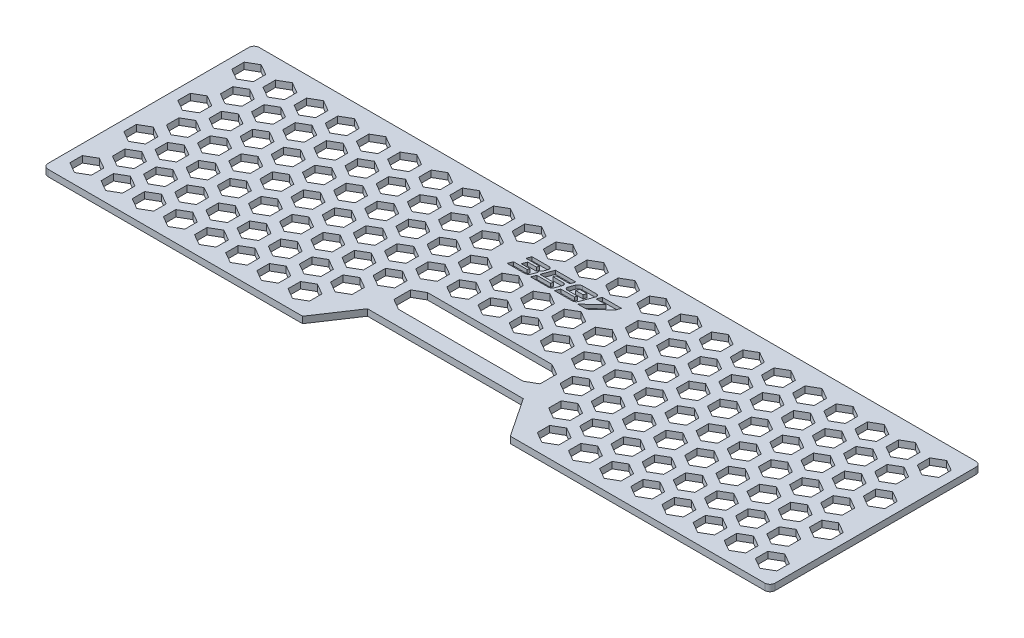
from build123d import *

# Parameters (mm, degrees)
BOSS_EXTRUDE1_DEPTH = 3.175
CUT_EXTRUDE1_DEPTH  = 197.755505707
FILL_PATTERN1_DEPTH = 3.175
CUT_EXTRUDE2_START  = -3.175
CUT_EXTRUDE2_DEPTH  = 3.175
BOSS_EXTRUDE3_DEPTH = 3.175
CUT_EXTRUDE3_DEPTH  = 1.778


with BuildPart() as part:
    # Sketch1 → Boss-Extrude1 (new body)
    with BuildSketch(Plane(origin=(0, 0, 0), x_dir=(1, 0, 0), z_dir=(0, 1, 0))):
        with BuildLine():
            Line((38.1, 0), (-38.1, 0))
            Line((-38.1, 0), (-50.8, -19.05))
            Line((-50.8, -19.05), (-175.26, -19.05))
            ThreePointArc((-175.26, -19.05), (-177.056051224, -18.306051224), (-177.8, -16.51))
            Line((-177.8, -16.51), (-177.8, 81.661))
            ThreePointArc((-177.8, 81.661), (-177.056051224, 83.457051224), (-175.26, 84.201))
            Line((-175.26, 84.201), (175.26, 84.201))
            ThreePointArc((175.26, 84.201), (177.056051224, 83.457051224), (177.8, 81.661))
            Line((177.8, 81.661), (177.8, -16.51))
            ThreePointArc((177.8, -16.51), (177.056051224, -18.306051224), (175.26, -19.05))
            Line((175.26, -19.05), (50.8, -19.05))
            Line((50.8, -19.05), (38.1, 0))
        make_face()
    extrude(amount=BOSS_EXTRUDE1_DEPTH)

    # Sketch3 → Cut-Extrude1 (cut, through all)
    with BuildSketch(Plane(origin=(0, 3.175, 0), x_dir=(1, 0, 0), z_dir=(0, 1, 0))):
        Polygon((-162.205526542, -10.934732959), (-162.205526542, -4.864198878), (-167.462763271, -1.828931837), (-172.72, -4.864198878), (-172.72, -10.934732959), (-167.462763271, -13.97), align=None)
    extrude(amount=-CUT_EXTRUDE1_DEPTH, mode=Mode.SUBTRACT)

    # Fill Pattern1: read off the stored shape, not the designer's step
    # Fill Pattern1 outline → Fill Pattern1 (cut)
    with BuildSketch(Plane(origin=(0, 0, 0), x_dir=(1, 0, 0), z_dir=(0, 1, 0))):
        Polygon((-167.462763271, 65.219362922), (-162.205526542, 68.254629963), (-162.205526542, 74.325164044), (-167.462763271, 77.360431085), (-172.72, 74.325164044), (-172.72, 68.254629963), align=None)
        Polygon((-167.462763271, 38.822908615), (-162.205526542, 41.858175655), (-162.205526542, 47.928709737), (-167.462763271, 50.963976777), (-172.72, 47.928709737), (-172.72, 41.858175655), align=None)
        Polygon((-167.462763271, 12.426454307), (-162.205526542, 15.461721348), (-162.205526542, 21.532255429), (-167.462763271, 24.56752247), (-172.72, 21.532255429), (-172.72, 15.461721348), align=None)
        Polygon((-104.14, 28.659948502), (-98.882763271, 25.624681461), (-93.625526542, 28.659948502), (-93.625526542, 34.730482583), (-98.882763271, 37.765749624), (-104.14, 34.730482583), align=None)
        Polygon((-81.28, 41.858175655), (-76.022763271, 38.822908615), (-70.765526542, 41.858175655), (-70.765526542, 47.928709737), (-76.022763271, 50.963976777), (-81.28, 47.928709737), align=None)
        Polygon((-149.86, 2.263494194), (-144.602763271, -0.771772846), (-139.345526542, 2.263494194), (-139.345526542, 8.334028276), (-144.602763271, 11.369295316), (-149.86, 8.334028276), align=None)
        Polygon((-127, 15.461721348), (-121.742763271, 12.426454307), (-116.485526542, 15.461721348), (-116.485526542, 21.532255429), (-121.742763271, 24.56752247), (-127, 21.532255429), align=None)
        Polygon((-58.42, 55.056402809), (-53.162763271, 52.021135768), (-47.905526542, 55.056402809), (-47.905526542, 61.12693689), (-53.162763271, 64.162203931), (-58.42, 61.12693689), align=None)
        Polygon((-35.56, 68.254629963), (-30.302763271, 65.219362922), (-25.045526542, 68.254629963), (-25.045526542, 74.325164044), (-30.302763271, 77.360431085), (-35.56, 74.325164044), align=None)
        Polygon((167.817236729, -13.97), (173.074473458, -10.934732959), (173.074473458, -4.864198878), (167.817236729, -1.828931837), (162.56, -4.864198878), (162.56, -10.934732959), align=None)
        Polygon((167.817236729, 65.219362922), (173.074473458, 68.254629963), (173.074473458, 74.325164044), (167.817236729, 77.360431085), (162.56, 74.325164044), (162.56, 68.254629963), align=None)
        Polygon((167.817236729, 38.822908615), (173.074473458, 41.858175655), (173.074473458, 47.928709737), (167.817236729, 50.963976777), (162.56, 47.928709737), (162.56, 41.858175655), align=None)
        Polygon((167.817236729, 12.426454307), (173.074473458, 15.461721348), (173.074473458, 21.532255429), (167.817236729, 24.56752247), (162.56, 21.532255429), (162.56, 15.461721348), align=None)
        Polygon((71.12, 47.928709737), (71.12, 41.858175655), (76.377236729, 38.822908615), (81.634473458, 41.858175655), (81.634473458, 47.928709737), (76.377236729, 50.963976777), align=None)
        Polygon((93.98, 34.730482583), (93.98, 28.659948502), (99.237236729, 25.624681461), (104.494473458, 28.659948502), (104.494473458, 34.730482583), (99.237236729, 37.765749624), align=None)
        Polygon((48.26, 61.12693689), (48.26, 55.056402809), (53.517236729, 52.021135768), (58.774473458, 55.056402809), (58.774473458, 61.12693689), (53.517236729, 64.162203931), align=None)
        Polygon((139.7, 8.334028276), (139.7, 2.263494194), (144.957236729, -0.771772846), (150.214473458, 2.263494194), (150.214473458, 8.334028276), (144.957236729, 11.369295316), align=None)
        Polygon((116.84, 21.532255429), (116.84, 15.461721348), (122.097236729, 12.426454307), (127.354473458, 15.461721348), (127.354473458, 21.532255429), (122.097236729, 24.56752247), align=None)
        Polygon((25.4, 74.325164044), (25.4, 68.254629963), (30.657236729, 65.219362922), (35.914473458, 68.254629963), (35.914473458, 74.325164044), (30.657236729, 77.360431085), align=None)
        Polygon((-144.602763271, 52.021135768), (-139.345526542, 55.056402809), (-139.345526542, 61.12693689), (-144.602763271, 64.162203931), (-149.86, 61.12693689), (-149.86, 55.056402809), align=None)
        Polygon((-144.602763271, 25.624681461), (-139.345526542, 28.659948502), (-139.345526542, 34.730482583), (-144.602763271, 37.765749624), (-149.86, 34.730482583), (-149.86, 28.659948502), align=None)
        Polygon((-127, 68.254629963), (-121.742763271, 65.219362922), (-116.485526542, 68.254629963), (-116.485526542, 74.325164044), (-121.742763271, 77.360431085), (-127, 74.325164044), align=None)
        Polygon((-81.28, 21.532255429), (-81.28, 15.461721348), (-76.022763271, 12.426454307), (-70.765526542, 15.461721348), (-70.765526542, 21.532255429), (-76.022763271, 24.56752247), align=None)
        Polygon((-127, 47.928709737), (-127, 41.858175655), (-121.742763271, 38.822908615), (-116.485526542, 41.858175655), (-116.485526542, 47.928709737), (-121.742763271, 50.963976777), align=None)
        Polygon((-58.42, 8.334028276), (-58.42, 2.263494194), (-53.162763271, -0.771772846), (-47.905526542, 2.263494194), (-47.905526542, 8.334028276), (-53.162763271, 11.369295316), align=None)
        Polygon((-136.982763271, 65.219362922), (-131.725526542, 68.254629963), (-131.725526542, 74.325164044), (-136.982763271, 77.360431085), (-142.24, 74.325164044), (-142.24, 68.254629963), align=None)
        Polygon((-136.982763271, 38.822908615), (-131.725526542, 41.858175655), (-131.725526542, 47.928709737), (-136.982763271, 50.963976777), (-142.24, 47.928709737), (-142.24, 41.858175655), align=None)
        Polygon((-136.982763271, -13.97), (-131.725526542, -10.934732959), (-131.725526542, -4.864198878), (-136.982763271, -1.828931837), (-142.24, -4.864198878), (-142.24, -10.934732959), align=None)
        Polygon((-136.982763271, 12.426454307), (-131.725526542, 15.461721348), (-131.725526542, 21.532255429), (-136.982763271, 24.56752247), (-142.24, 21.532255429), (-142.24, 15.461721348), align=None)
        Polygon((-165.1, 55.056402809), (-159.842763271, 52.021135768), (-154.585526542, 55.056402809), (-154.585526542, 61.12693689), (-159.842763271, 64.162203931), (-165.1, 61.12693689), align=None)
        Polygon((-96.52, 47.928709737), (-96.52, 41.858175655), (-91.262763271, 38.822908615), (-86.005526542, 41.858175655), (-86.005526542, 47.928709737), (-91.262763271, 50.963976777), align=None)
        Polygon((-73.66, 34.730482583), (-73.66, 28.659948502), (-68.402763271, 25.624681461), (-63.145526542, 28.659948502), (-63.145526542, 34.730482583), (-68.402763271, 37.765749624), align=None)
        Polygon((-119.38, 61.12693689), (-119.38, 55.056402809), (-114.122763271, 52.021135768), (-108.865526542, 55.056402809), (-108.865526542, 61.12693689), (-114.122763271, 64.162203931), align=None)
        Polygon((-50.8, 21.532255429), (-50.8, 15.461721348), (-45.542763271, 12.426454307), (-40.285526542, 15.461721348), (-40.285526542, 21.532255429), (-45.542763271, 24.56752247), align=None)
        Polygon((-159.842763271, -0.771772846), (-154.585526542, 2.263494194), (-154.585526542, 8.334028276), (-159.842763271, 11.369295316), (-165.1, 8.334028276), (-165.1, 2.263494194), align=None)
        Polygon((-159.842763271, 25.624681461), (-154.585526542, 28.659948502), (-154.585526542, 34.730482583), (-159.842763271, 37.765749624), (-165.1, 34.730482583), (-165.1, 28.659948502), align=None)
        Polygon((-73.66, 55.056402809), (-68.402763271, 52.021135768), (-63.145526542, 55.056402809), (-63.145526542, 61.12693689), (-68.402763271, 64.162203931), (-73.66, 61.12693689), align=None)
        Polygon((-119.38, 28.659948502), (-114.122763271, 25.624681461), (-108.865526542, 28.659948502), (-108.865526542, 34.730482583), (-114.122763271, 37.765749624), (-119.38, 34.730482583), align=None)
        Polygon((-50.8, 68.254629963), (-45.542763271, 65.219362922), (-40.285526542, 68.254629963), (-40.285526542, 74.325164044), (-45.542763271, 77.360431085), (-50.8, 74.325164044), align=None)
        Polygon((-152.222763271, 12.426454307), (-146.965526542, 15.461721348), (-146.965526542, 21.532255429), (-152.222763271, 24.56752247), (-157.48, 21.532255429), (-157.48, 15.461721348), align=None)
        Polygon((-152.222763271, 38.822908615), (-146.965526542, 41.858175655), (-146.965526542, 47.928709737), (-152.222763271, 50.963976777), (-157.48, 47.928709737), (-157.48, 41.858175655), align=None)
        Polygon((-152.222763271, 65.219362922), (-146.965526542, 68.254629963), (-146.965526542, 74.325164044), (-152.222763271, 77.360431085), (-157.48, 74.325164044), (-157.48, 68.254629963), align=None)
        Polygon((-152.222763271, -13.97), (-146.965526542, -10.934732959), (-146.965526542, -4.864198878), (-152.222763271, -1.828931837), (-157.48, -4.864198878), (-157.48, -10.934732959), align=None)
        Polygon((-88.9, 55.056402809), (-83.642763271, 52.021135768), (-78.385526542, 55.056402809), (-78.385526542, 61.12693689), (-83.642763271, 64.162203931), (-88.9, 61.12693689), align=None)
        Polygon((-66.04, 68.254629963), (-60.782763271, 65.219362922), (-55.525526542, 68.254629963), (-55.525526542, 74.325164044), (-60.782763271, 77.360431085), (-66.04, 74.325164044), align=None)
        Polygon((-134.62, 28.659948502), (-129.362763271, 25.624681461), (-124.105526542, 28.659948502), (-124.105526542, 34.730482583), (-129.362763271, 37.765749624), (-134.62, 34.730482583), align=None)
        Polygon((-111.76, 41.858175655), (-106.502763271, 38.822908615), (-101.245526542, 41.858175655), (-101.245526542, 47.928709737), (-106.502763271, 50.963976777), (-111.76, 47.928709737), align=None)
        Polygon((-111.76, -4.864198878), (-111.76, -10.934732959), (-106.502763271, -13.97), (-101.245526542, -10.934732959), (-101.245526542, -4.864198878), (-106.502763271, -1.828931837), align=None)
        Polygon((-134.62, 8.334028276), (-134.62, 2.263494194), (-129.362763271, -0.771772846), (-124.105526542, 2.263494194), (-124.105526542, 8.334028276), (-129.362763271, 11.369295316), align=None)
        Polygon((-81.28, 68.254629963), (-76.022763271, 65.219362922), (-70.765526542, 68.254629963), (-70.765526542, 74.325164044), (-76.022763271, 77.360431085), (-81.28, 74.325164044), align=None)
        Polygon((-104.14, 55.056402809), (-98.882763271, 52.021135768), (-93.625526542, 55.056402809), (-93.625526542, 61.12693689), (-98.882763271, 64.162203931), (-104.14, 61.12693689), align=None)
        Polygon((-104.14, 8.334028276), (-104.14, 2.263494194), (-98.882763271, -0.771772846), (-93.625526542, 2.263494194), (-93.625526542, 8.334028276), (-98.882763271, 11.369295316), align=None)
        Polygon((-81.28, -4.864198878), (-81.28, -10.934732959), (-76.022763271, -13.97), (-70.765526542, -10.934732959), (-70.765526542, -4.864198878), (-76.022763271, -1.828931837), align=None)
        Polygon((-96.52, 68.254629963), (-91.262763271, 65.219362922), (-86.005526542, 68.254629963), (-86.005526542, 74.325164044), (-91.262763271, 77.360431085), (-96.52, 74.325164044), align=None)
        Polygon((-96.52, 21.532255429), (-96.52, 15.461721348), (-91.262763271, 12.426454307), (-86.005526542, 15.461721348), (-86.005526542, 21.532255429), (-91.262763271, 24.56752247), align=None)
        Polygon((-73.66, 8.334028276), (-73.66, 2.263494194), (-68.402763271, -0.771772846), (-63.145526542, 2.263494194), (-63.145526542, 8.334028276), (-68.402763271, 11.369295316), align=None)
        Polygon((-129.362763271, 52.021135768), (-124.105526542, 55.056402809), (-124.105526542, 61.12693689), (-129.362763271, 64.162203931), (-134.62, 61.12693689), (-134.62, 55.056402809), align=None)
        Polygon((-111.76, 68.254629963), (-106.502763271, 65.219362922), (-101.245526542, 68.254629963), (-101.245526542, 74.325164044), (-106.502763271, 77.360431085), (-111.76, 74.325164044), align=None)
        Polygon((-88.9, 34.730482583), (-88.9, 28.659948502), (-83.642763271, 25.624681461), (-78.385526542, 28.659948502), (-78.385526542, 34.730482583), (-83.642763271, 37.765749624), align=None)
        Polygon((-66.04, 21.532255429), (-66.04, 15.461721348), (-60.782763271, 12.426454307), (-55.525526542, 15.461721348), (-55.525526542, 21.532255429), (-60.782763271, 24.56752247), align=None)
        Polygon((-121.742763271, -13.97), (-116.485526542, -10.934732959), (-116.485526542, -4.864198878), (-121.742763271, -1.828931837), (-127, -4.864198878), (-127, -10.934732959), align=None)
        Polygon((-35.56, 21.532255429), (-35.56, 15.461721348), (-30.302763271, 12.426454307), (-25.045526542, 15.461721348), (-25.045526542, 21.532255429), (-30.302763271, 24.56752247), align=None)
        Polygon((-58.42, 34.730482583), (-58.42, 28.659948502), (-53.162763271, 25.624681461), (-47.905526542, 28.659948502), (-47.905526542, 34.730482583), (-53.162763271, 37.765749624), align=None)
        Polygon((-111.76, 21.532255429), (-111.76, 15.461721348), (-106.502763271, 12.426454307), (-101.245526542, 15.461721348), (-101.245526542, 21.532255429), (-106.502763271, 24.56752247), align=None)
        Polygon((-88.9, 8.334028276), (-88.9, 2.263494194), (-83.642763271, -0.771772846), (-78.385526542, 2.263494194), (-78.385526542, 8.334028276), (-83.642763271, 11.369295316), align=None)
        Polygon((-66.04, -4.864198878), (-66.04, -10.934732959), (-60.782763271, -13.97), (-55.525526542, -10.934732959), (-55.525526542, -4.864198878), (-60.782763271, -1.828931837), align=None)
        Polygon((-96.52, -4.864198878), (-96.52, -10.934732959), (-91.262763271, -13.97), (-86.005526542, -10.934732959), (-86.005526542, -4.864198878), (-91.262763271, -1.828931837), align=None)
        Polygon((-119.38, 8.334028276), (-119.38, 2.263494194), (-114.122763271, -0.771772846), (-108.865526542, 2.263494194), (-108.865526542, 8.334028276), (-114.122763271, 11.369295316), align=None)
        Polygon((91.617236729, 65.219362922), (96.874473458, 68.254629963), (96.874473458, 74.325164044), (91.617236729, 77.360431085), (86.36, 74.325164044), (86.36, 68.254629963), align=None)
        Polygon((91.617236729, 12.426454307), (96.874473458, 15.461721348), (96.874473458, 21.532255429), (91.617236729, 24.56752247), (86.36, 21.532255429), (86.36, 15.461721348), align=None)
        Polygon((91.617236729, 38.822908615), (96.874473458, 41.858175655), (96.874473458, 47.928709737), (91.617236729, 50.963976777), (86.36, 47.928709737), (86.36, 41.858175655), align=None)
        Polygon((91.617236729, -13.97), (96.874473458, -10.934732959), (96.874473458, -4.864198878), (91.617236729, -1.828931837), (86.36, -4.864198878), (86.36, -10.934732959), align=None)
        Polygon((40.64, 41.858175655), (45.897236729, 38.822908615), (51.154473458, 41.858175655), (51.154473458, 47.928709737), (45.897236729, 50.963976777), (40.64, 47.928709737), align=None)
        Polygon((17.78, 28.659948502), (23.037236729, 25.624681461), (28.294473458, 28.659948502), (28.294473458, 34.730482583), (23.037236729, 37.765749624), (17.78, 34.730482583), align=None)
        Polygon((63.5, 55.056402809), (68.757236729, 52.021135768), (74.014473458, 55.056402809), (74.014473458, 61.12693689), (68.757236729, 64.162203931), (63.5, 61.12693689), align=None)
        Polygon((-5.08, 15.461721348), (0.177236729, 12.426454307), (5.434473458, 15.461721348), (5.434473458, 21.532255429), (0.177236729, 24.56752247), (-5.08, 21.532255429), align=None)
        Polygon((154.94, 34.730482583), (154.94, 28.659948502), (160.197236729, 25.624681461), (165.454473458, 28.659948502), (165.454473458, 34.730482583), (160.197236729, 37.765749624), align=None)
        Polygon((109.22, 61.12693689), (109.22, 55.056402809), (114.477236729, 52.021135768), (119.734473458, 55.056402809), (119.734473458, 61.12693689), (114.477236729, 64.162203931), align=None)
        Polygon((132.08, 47.928709737), (132.08, 41.858175655), (137.337236729, 38.822908615), (142.594473458, 41.858175655), (142.594473458, 47.928709737), (137.337236729, 50.963976777), align=None)
        Polygon((61.137236729, -13.97), (66.394473458, -10.934732959), (66.394473458, -4.864198878), (61.137236729, -1.828931837), (55.88, -4.864198878), (55.88, -10.934732959), align=None)
        Polygon((61.137236729, 12.426454307), (66.394473458, 15.461721348), (66.394473458, 21.532255429), (61.137236729, 24.56752247), (55.88, 21.532255429), (55.88, 15.461721348), align=None)
        Polygon((61.137236729, 38.822908615), (66.394473458, 41.858175655), (66.394473458, 47.928709737), (61.137236729, 50.963976777), (55.88, 47.928709737), (55.88, 41.858175655), align=None)
        Polygon((61.137236729, 65.219362922), (66.394473458, 68.254629963), (66.394473458, 74.325164044), (61.137236729, 77.360431085), (55.88, 74.325164044), (55.88, 68.254629963), align=None)
        Polygon((78.74, 2.263494194), (83.997236729, -0.771772846), (89.254473458, 2.263494194), (89.254473458, 8.334028276), (83.997236729, 11.369295316), (78.74, 8.334028276), align=None)
        Polygon((147.32, 41.858175655), (152.577236729, 38.822908615), (157.834473458, 41.858175655), (157.834473458, 47.928709737), (152.577236729, 50.963976777), (147.32, 47.928709737), align=None)
        Polygon((101.6, 15.461721348), (106.857236729, 12.426454307), (112.114473458, 15.461721348), (112.114473458, 21.532255429), (106.857236729, 24.56752247), (101.6, 21.532255429), align=None)
        Polygon((124.46, 28.659948502), (129.717236729, 25.624681461), (134.974473458, 28.659948502), (134.974473458, 34.730482583), (129.717236729, 37.765749624), (124.46, 34.730482583), align=None)
        Polygon((10.16, 21.532255429), (10.16, 15.461721348), (15.417236729, 12.426454307), (20.674473458, 15.461721348), (20.674473458, 21.532255429), (15.417236729, 24.56752247), align=None)
        Polygon((-12.7, 34.730482583), (-12.7, 28.659948502), (-7.442763271, 25.624681461), (-2.185526542, 28.659948502), (-2.185526542, 34.730482583), (-7.442763271, 37.765749624), align=None)
        Polygon((-35.56, 47.928709737), (-35.56, 41.858175655), (-30.302763271, 38.822908615), (-25.045526542, 41.858175655), (-25.045526542, 47.928709737), (-30.302763271, 50.963976777), align=None)
        Polygon((68.757236729, -0.771772846), (74.014473458, 2.263494194), (74.014473458, 8.334028276), (68.757236729, 11.369295316), (63.5, 8.334028276), (63.5, 2.263494194), align=None)
        Polygon((68.757236729, 25.624681461), (74.014473458, 28.659948502), (74.014473458, 34.730482583), (68.757236729, 37.765749624), (63.5, 34.730482583), (63.5, 28.659948502), align=None)
        Polygon((154.94, 55.056402809), (160.197236729, 52.021135768), (165.454473458, 55.056402809), (165.454473458, 61.12693689), (160.197236729, 64.162203931), (154.94, 61.12693689), align=None)
        Polygon((109.22, 28.659948502), (114.477236729, 25.624681461), (119.734473458, 28.659948502), (119.734473458, 34.730482583), (114.477236729, 37.765749624), (109.22, 34.730482583), align=None)
        Polygon((40.64, 21.532255429), (40.64, 15.461721348), (45.897236729, 12.426454307), (51.154473458, 15.461721348), (51.154473458, 21.532255429), (45.897236729, 24.56752247), align=None)
        Polygon((-5.08, 47.928709737), (-5.08, 41.858175655), (0.177236729, 38.822908615), (5.434473458, 41.858175655), (5.434473458, 47.928709737), (0.177236729, 50.963976777), align=None)
        Polygon((-27.94, 61.12693689), (-27.94, 55.056402809), (-22.682763271, 52.021135768), (-17.425526542, 55.056402809), (-17.425526542, 61.12693689), (-22.682763271, 64.162203931), align=None)
        Polygon((76.377236729, 12.426454307), (81.634473458, 15.461721348), (81.634473458, 21.532255429), (76.377236729, 24.56752247), (71.12, 21.532255429), (71.12, 15.461721348), align=None)
        Polygon((76.377236729, -13.97), (81.634473458, -10.934732959), (81.634473458, -4.864198878), (76.377236729, -1.828931837), (71.12, -4.864198878), (71.12, -10.934732959), align=None)
        Polygon((76.377236729, 65.219362922), (81.634473458, 68.254629963), (81.634473458, 74.325164044), (76.377236729, 77.360431085), (71.12, 74.325164044), (71.12, 68.254629963), align=None)
        Polygon((48.26, 2.263494194), (53.517236729, -0.771772846), (58.774473458, 2.263494194), (58.774473458, 8.334028276), (53.517236729, 11.369295316), (48.26, 8.334028276), align=None)
        Polygon((116.84, 41.858175655), (122.097236729, 38.822908615), (127.354473458, 41.858175655), (127.354473458, 47.928709737), (122.097236729, 50.963976777), (116.84, 47.928709737), align=None)
        Polygon((139.7, 55.056402809), (144.957236729, 52.021135768), (150.214473458, 55.056402809), (150.214473458, 61.12693689), (144.957236729, 64.162203931), (139.7, 61.12693689), align=None)
        Polygon((25.4, 47.928709737), (25.4, 41.858175655), (30.657236729, 38.822908615), (35.914473458, 41.858175655), (35.914473458, 47.928709737), (30.657236729, 50.963976777), align=None)
        Polygon((48.26, 34.730482583), (48.26, 28.659948502), (53.517236729, 25.624681461), (58.774473458, 28.659948502), (58.774473458, 34.730482583), (53.517236729, 37.765749624), align=None)
        Polygon((116.84, -4.864198878), (116.84, -10.934732959), (122.097236729, -13.97), (127.354473458, -10.934732959), (127.354473458, -4.864198878), (122.097236729, -1.828931837), align=None)
        Polygon((93.98, 8.334028276), (93.98, 2.263494194), (99.237236729, -0.771772846), (104.494473458, 2.263494194), (104.494473458, 8.334028276), (99.237236729, 11.369295316), align=None)
        Polygon((-20.32, 74.325164044), (-20.32, 68.254629963), (-15.062763271, 65.219362922), (-9.805526542, 68.254629963), (-9.805526542, 74.325164044), (-15.062763271, 77.360431085), align=None)
        Polygon((2.54, 61.12693689), (2.54, 55.056402809), (7.797236729, 52.021135768), (13.054473458, 55.056402809), (13.054473458, 61.12693689), (7.797236729, 64.162203931), align=None)
        Polygon((83.997236729, 52.021135768), (89.254473458, 55.056402809), (89.254473458, 61.12693689), (83.997236729, 64.162203931), (78.74, 61.12693689), (78.74, 55.056402809), align=None)
        Polygon((83.997236729, 25.624681461), (89.254473458, 28.659948502), (89.254473458, 34.730482583), (83.997236729, 37.765749624), (78.74, 34.730482583), (78.74, 28.659948502), align=None)
        Polygon((101.6, 68.254629963), (106.857236729, 65.219362922), (112.114473458, 68.254629963), (112.114473458, 74.325164044), (106.857236729, 77.360431085), (101.6, 74.325164044), align=None)
        Polygon((33.02, 28.659948502), (38.277236729, 25.624681461), (43.534473458, 28.659948502), (43.534473458, 34.730482583), (38.277236729, 37.765749624), (33.02, 34.730482583), align=None)
        Polygon((147.32, 21.532255429), (147.32, 15.461721348), (152.577236729, 12.426454307), (157.834473458, 15.461721348), (157.834473458, 21.532255429), (152.577236729, 24.56752247), align=None)
        Polygon((101.6, 47.928709737), (101.6, 41.858175655), (106.857236729, 38.822908615), (112.114473458, 41.858175655), (112.114473458, 47.928709737), (106.857236729, 50.963976777), align=None)
        Polygon((93.98, 55.056402809), (99.237236729, 52.021135768), (104.494473458, 55.056402809), (104.494473458, 61.12693689), (99.237236729, 64.162203931), (93.98, 61.12693689), align=None)
        Polygon((25.4, 15.461721348), (30.657236729, 12.426454307), (35.914473458, 15.461721348), (35.914473458, 21.532255429), (30.657236729, 24.56752247), (25.4, 21.532255429), align=None)
        Polygon((116.84, 68.254629963), (122.097236729, 65.219362922), (127.354473458, 68.254629963), (127.354473458, 74.325164044), (122.097236729, 77.360431085), (116.84, 74.325164044), align=None)
        Polygon((132.08, 68.254629963), (137.337236729, 65.219362922), (142.594473458, 68.254629963), (142.594473458, 74.325164044), (137.337236729, 77.360431085), (132.08, 74.325164044), align=None)
        Polygon((132.08, -4.864198878), (132.08, -10.934732959), (137.337236729, -13.97), (142.594473458, -10.934732959), (142.594473458, -4.864198878), (137.337236729, -1.828931837), align=None)
        Polygon((109.22, 8.334028276), (109.22, 2.263494194), (114.477236729, -0.771772846), (119.734473458, 2.263494194), (119.734473458, 8.334028276), (114.477236729, 11.369295316), align=None)
        Polygon((-5.08, 74.325164044), (-5.08, 68.254629963), (0.177236729, 65.219362922), (5.434473458, 68.254629963), (5.434473458, 74.325164044), (0.177236729, 77.360431085), align=None)
        Polygon((17.78, 61.12693689), (17.78, 55.056402809), (23.037236729, 52.021135768), (28.294473458, 55.056402809), (28.294473458, 61.12693689), (23.037236729, 64.162203931), align=None)
        Polygon((147.32, 68.254629963), (152.577236729, 65.219362922), (157.834473458, 68.254629963), (157.834473458, 74.325164044), (152.577236729, 77.360431085), (147.32, 74.325164044), align=None)
        Polygon((124.46, 55.056402809), (129.717236729, 52.021135768), (134.974473458, 55.056402809), (134.974473458, 61.12693689), (129.717236729, 64.162203931), (124.46, 61.12693689), align=None)
        Polygon((101.6, -4.864198878), (101.6, -10.934732959), (106.857236729, -13.97), (112.114473458, -10.934732959), (112.114473458, -4.864198878), (106.857236729, -1.828931837), align=None)
        Polygon((-12.7, 61.12693689), (-12.7, 55.056402809), (-7.442763271, 52.021135768), (-2.185526542, 55.056402809), (-2.185526542, 61.12693689), (-7.442763271, 64.162203931), align=None)
        Polygon((10.16, 47.928709737), (10.16, 41.858175655), (15.417236729, 38.822908615), (20.674473458, 41.858175655), (20.674473458, 47.928709737), (15.417236729, 50.963976777), align=None)
        Polygon((139.7, 28.659948502), (144.957236729, 25.624681461), (150.214473458, 28.659948502), (150.214473458, 34.730482583), (144.957236729, 37.765749624), (139.7, 34.730482583), align=None)
        Polygon((-20.32, 47.928709737), (-20.32, 41.858175655), (-15.062763271, 38.822908615), (-9.805526542, 41.858175655), (-9.805526542, 47.928709737), (-15.062763271, 50.963976777), align=None)
        Polygon((2.54, 34.730482583), (2.54, 28.659948502), (7.797236729, 25.624681461), (13.054473458, 28.659948502), (13.054473458, 34.730482583), (7.797236729, 37.765749624), align=None)
        Polygon((-43.18, 61.12693689), (-43.18, 55.056402809), (-37.922763271, 52.021135768), (-32.665526542, 55.056402809), (-32.665526542, 61.12693689), (-37.922763271, 64.162203931), align=None)
        Polygon((40.64, 74.325164044), (40.64, 68.254629963), (45.897236729, 65.219362922), (51.154473458, 68.254629963), (51.154473458, 74.325164044), (45.897236729, 77.360431085), align=None)
        Polygon((132.08, 21.532255429), (132.08, 15.461721348), (137.337236729, 12.426454307), (142.594473458, 15.461721348), (142.594473458, 21.532255429), (137.337236729, 24.56752247), align=None)
        Polygon((154.94, 8.334028276), (154.94, 2.263494194), (160.197236729, -0.771772846), (165.454473458, 2.263494194), (165.454473458, 8.334028276), (160.197236729, 11.369295316), align=None)
        Polygon((33.02, 61.12693689), (33.02, 55.056402809), (38.277236729, 52.021135768), (43.534473458, 55.056402809), (43.534473458, 61.12693689), (38.277236729, 64.162203931), align=None)
        Polygon((124.46, 8.334028276), (124.46, 2.263494194), (129.717236729, -0.771772846), (134.974473458, 2.263494194), (134.974473458, 8.334028276), (129.717236729, 11.369295316), align=None)
        Polygon((147.32, -4.864198878), (147.32, -10.934732959), (152.577236729, -13.97), (157.834473458, -10.934732959), (157.834473458, -4.864198878), (152.577236729, -1.828931837), align=None)
        Polygon((10.16, 74.325164044), (10.16, 68.254629963), (15.417236729, 65.219362922), (20.674473458, 68.254629963), (20.674473458, 74.325164044), (15.417236729, 77.360431085), align=None)
        Polygon((-27.94, 28.659948502), (-22.682763271, 25.624681461), (-17.425526542, 28.659948502), (-17.425526542, 34.730482583), (-22.682763271, 37.765749624), (-27.94, 34.730482583), align=None)
        Polygon((-20.32, 15.461721348), (-15.062763271, 12.426454307), (-9.805526542, 15.461721348), (-9.805526542, 21.532255429), (-15.062763271, 24.56752247), (-20.32, 21.532255429), align=None)
        Polygon((-43.18, 28.659948502), (-37.922763271, 25.624681461), (-32.665526542, 28.659948502), (-32.665526542, 34.730482583), (-37.922763271, 37.765749624), (-43.18, 34.730482583), align=None)
        Polygon((-50.8, 41.858175655), (-45.542763271, 38.822908615), (-40.285526542, 41.858175655), (-40.285526542, 47.928709737), (-45.542763271, 50.963976777), (-50.8, 47.928709737), align=None)
        Polygon((-66.04, 47.928709737), (-66.04, 41.858175655), (-60.782763271, 38.822908615), (-55.525526542, 41.858175655), (-55.525526542, 47.928709737), (-60.782763271, 50.963976777), align=None)
    extrude(amount=FILL_PATTERN1_DEPTH, mode=Mode.SUBTRACT)

    # Cut-Extrude2: read off the stored shape, not the designer's step
    # Cut-Extrude2 outline → Cut-Extrude2 (cut)
    with BuildSketch(Plane(origin=(0, 3.175, 0), x_dir=(1, 0, 0), z_dir=(0, 1, 0)).offset(CUT_EXTRUDE2_START)):
        Polygon((30.657236729, 7.346454307), (35.914473458, 10.381721348), (35.914473458, 15.461721348), (30.657236729, 12.426454307), (25.4, 15.461721348), (25.4, 21.532255429), (20.674473458, 21.532255429), (20.674473458, 15.461721348), (15.417236729, 12.426454307), (10.16, 15.461721348), (10.16, 21.532255429), (5.434473458, 21.532255429), (5.434473458, 15.461721348), (0.177236729, 12.426454307), (-5.08, 15.461721348), (-5.08, 21.532255429), (-9.805526542, 21.532255429), (-9.805526542, 15.461721348), (-15.062763271, 12.426454307), (-20.32, 15.461721348), (-20.32, 21.532255429), (-25.045526542, 21.532255429), (-25.045526542, 15.461721348), (-30.302763271, 12.426454307), (-35.56, 15.461721348), (-35.56, 10.381721348), (-30.302763271, 7.346454307), align=None)
    extrude(amount=CUT_EXTRUDE2_DEPTH, mode=Mode.SUBTRACT)

    # Sketch6 → Boss-Extrude3 (add)
    with BuildSketch(Plane(origin=(0, 3.175, 0), x_dir=(1, 0, 0), z_dir=(0, 1, 0))):
        Polygon((-35.56, 21.532255429), (-30.302763271, 24.56752247), (30.657236729, 24.56752247), (35.914473458, 21.532255429), (35.914473458, 18.496988389), (30.657236729, 21.532255429), (-30.302763271, 21.532255429), (-35.56, 18.496988389), align=None)
        Polygon((-27.94, 61.12693689), (-22.682763271, 64.162203931), (23.037236729, 64.162203931), (28.294473458, 61.12693689), (28.294473458, 55.056402809), (23.037236729, 52.021135768), (-22.682763271, 52.021135768), (-27.94, 55.056402809), align=None)
    extrude(amount=-BOSS_EXTRUDE3_DEPTH)

    # Sketch8 → Cut-Extrude3 (cut)
    # profile 1 of 4: a face of its own
    with BuildSketch(Plane(origin=(0, 3.175, 0), x_dir=(1, 0, 0), z_dir=(0, 1, 0))):
        with BuildLine():
            Line((-19.934127908, 62.274608729), (-11.504027252, 62.274608729))
            add(Edge.make_bspline(
                [(-11.504027252, 62.274608729), (-11.457499732, 62.272658854), (-11.366068707, 62.268827163), (-11.232102829, 62.249082776), (-11.106013845, 62.210301943), (-10.987190818, 62.159244364), (-10.876464868, 62.090353537), (-10.773690255, 62.007369919), (-10.675875767, 61.910883247), (-10.591111724, 61.798748824), (-10.513834939, 61.68112141), (-10.455597816, 61.556817572), (-10.41257159, 61.431441958), (-10.38998475, 61.302314347), (-10.383682286, 61.170842332), (-10.394665103, 61.036750962), (-10.421299323, 60.899400918), (-10.453285913, 60.80992839), (-10.469773975, 60.763808168)],
                knots=[0, 0, 0, 0, 1.033858684, 2.031631167, 2.996522225, 3.955246206, 4.895730905, 5.88202336, 6.884066945, 7.937814813, 8.997512618, 10.00345545, 10.977645699, 11.932401845, 12.903909377, 13.892724477, 14.913766951, 16, 16, 16, 16], degree=3))
            Line((-10.469773975, 60.763808168), (-11.131529593, 58.965830639))
            add(Edge.make_bspline(
                [(-11.131529593, 58.965830639), (-11.168309541, 58.890176102), (-11.239862904, 58.742994365), (-11.3672128, 58.540125479), (-11.508515789, 58.36081803), (-11.664305216, 58.21336366), (-11.812003169, 58.088489257), (-11.946305226, 57.992362126), (-12.059538771, 57.920436646), (-12.183384535, 57.870139407), (-12.313317978, 57.839717529), (-12.411219922, 57.832734385), (-12.455040829, 57.829608729)],
                knots=[0, 0, 0, 0, 1.379534441, 2.683808315, 3.922825362, 5.114129912, 6.196961014, 7.094084354, 7.824161201, 8.390660576, 9.279659734, 10, 10, 10, 10], degree=3))
            add(Edge.make_bspline(
                [(-12.455040829, 57.829608729), (-12.392980134, 57.810628145), (-12.27513635, 57.774586913), (-12.122681634, 57.684206502), (-12.005351522, 57.571199754), (-11.924507672, 57.434102256), (-11.884067065, 57.273725918), (-11.87983235, 57.092591042), (-11.910658788, 56.890305463), (-11.954864932, 56.752485811), (-11.978493544, 56.678819872)],
                knots=[0, 0, 0, 0, 1.070915193, 2.033504429, 2.901981661, 3.740591546, 4.631533105, 5.607780627, 6.721335573, 8, 8, 8, 8], degree=3))
            Line((-11.978493544, 56.678819872), (-12.640249162, 54.880842344))
            add(Edge.make_bspline(
                [(-12.640249162, 54.880842344), (-12.68025033, 54.769570093), (-12.758646386, 54.551493817), (-12.938898513, 54.255418638), (-13.161495944, 53.993712523), (-13.427853068, 53.773520741), (-13.722821652, 53.593865834), (-14.040610015, 53.46333498), (-14.378093378, 53.383279079), (-14.609816353, 53.37449985), (-14.727484649, 53.370041782)],
                knots=[0, 0, 0, 0, 1.026055652, 2.010909244, 2.994949672, 4.001311588, 5.002725891, 5.987376255, 6.977995145, 8, 8, 8, 8], degree=3))
            Line((-14.727484649, 53.370041782), (-23.155504312, 53.370041782))
            Line((-23.155504312, 53.370041782), (-22.306459368, 55.642485602))
            Line((-22.306459368, 55.642485602), (-15.676417234, 55.642485602))
            Line((-15.676417234, 55.642485602), (-15.287271634, 56.678819872))
            Line((-15.287271634, 56.678819872), (-19.559549256, 56.678819872))
            Line((-19.559549256, 56.678819872), (-18.695937365, 58.965830639))
            Line((-18.695937365, 58.965830639), (-14.438226691, 58.965830639))
            Line((-14.438226691, 58.965830639), (-14.065729031, 60.10205255))
            Line((-14.065729031, 60.10205255), (-20.695771166, 60.10205255))
            Line((-20.695771166, 60.10205255), (-19.934127908, 62.274608729))
        make_face()
    # profile 2 of 4: a face of its own
    with BuildSketch(Plane(origin=(0, 3.175, 0), x_dir=(1, 0, 0), z_dir=(0, 1, 0))):
        with BuildLine():
            Line((1.564605706, 62.274608729), (-8.476183151, 62.274608729))
            Line((-8.476183151, 62.274608729), (-10.4905839, 56.720439722))
            Line((-10.4905839, 56.720439722), (-3.787707028, 56.720439722))
            Line((-3.787707028, 56.720439722), (-4.233039425, 55.571731857))
            Line((-4.233039425, 55.571731857), (-10.877648507, 55.571731857))
            Line((-10.877648507, 55.571731857), (-11.712126503, 53.370041782))
            Line((-11.712126503, 53.370041782), (-3.240405998, 53.370041782))
            add(Edge.make_bspline(
                [(-3.240405998, 53.370041782), (-3.123487131, 53.374855148), (-2.892873594, 53.384349146), (-2.557259583, 53.459247911), (-2.240912088, 53.581317755), (-1.947625136, 53.749575596), (-1.684226778, 53.961396237), (-1.462777743, 54.214522358), (-1.277762139, 54.500748092), (-1.196603414, 54.713946113), (-1.155251503, 54.822574553)],
                knots=[0, 0, 0, 0, 1.031771056, 2.035089617, 3.020272431, 4.016402688, 5.009476802, 5.990307642, 6.976023584, 8, 8, 8, 8], degree=3))
            Line((-1.155251503, 54.822574553), (-0.206318919, 57.425896182))
            add(Edge.make_bspline(
                [(-0.206318919, 57.425896182), (-0.191579485, 57.472128973), (-0.162866692, 57.562191627), (-0.135129496, 57.698766073), (-0.12446982, 57.832944137), (-0.130606179, 57.964417381), (-0.153385855, 58.092592652), (-0.194312741, 58.21639061), (-0.24839698, 58.338336157), (-0.318971251, 58.455124083), (-0.400016013, 58.564463871), (-0.493560364, 58.658938112), (-0.593631797, 58.741590058), (-0.703784054, 58.808060946), (-0.823260739, 58.858306459), (-0.949308922, 58.896319924), (-1.085244836, 58.916623864), (-1.178082192, 58.920255256), (-1.226005249, 58.922129797)],
                knots=[0, 0, 0, 0, 1.087331938, 2.118150314, 3.116432757, 4.097241922, 5.061139316, 6.02503671, 7.013459632, 8.045567484, 9.078143837, 10.056855012, 11.018617526, 11.981385278, 12.928834863, 13.917869244, 14.925194831, 16, 16, 16, 16], degree=3))
            Line((-1.226005249, 58.922129797), (-6.361894762, 58.922129797))
            Line((-6.361894762, 58.922129797), (-5.916562365, 60.029217812))
            Line((-5.916562365, 60.029217812), (0.744694658, 60.029217812))
            Line((0.744694658, 60.029217812), (1.564605706, 62.274608729))
        make_face()
    # profile 3 of 4: a face of its own
    with BuildSketch(Plane(origin=(0, 3.175, 0), x_dir=(1, 0, 0), z_dir=(0, 1, 0))):
        with BuildLine():
            Line((0.008023309, 53.370041782), (0.813367411, 55.627918654))
            Line((0.813367411, 55.627918654), (7.530811231, 55.627918654))
            Line((7.530811231, 55.627918654), (7.890822935, 56.720439722))
            Line((7.890822935, 56.720439722), (2.784067317, 56.720439722))
            add(Edge.make_bspline(
                [(2.784067317, 56.720439722), (2.739548181, 56.721206093), (2.651959645, 56.722713878), (2.525170914, 56.747402588), (2.405148146, 56.78174647), (2.293379483, 56.83283442), (2.188629814, 56.897988664), (2.090267645, 56.977190866), (2.000463443, 57.072488912), (1.89142864, 57.21427629), (1.783856621, 57.409125269), (1.713038384, 57.662432222), (1.700460746, 57.927609953), (1.741307594, 58.100676453), (1.762299995, 58.189620433)],
                knots=[0, 0, 0, 0, 0.770041818, 1.515007746, 2.229893502, 2.929150895, 3.636214576, 4.362625833, 5.110687737, 5.899173509, 7.458829341, 8.931451978, 10.422982656, 12, 12, 12, 12], degree=3))
            Line((1.762299995, 58.189620433), (2.711232579, 60.819994965))
            add(Edge.make_bspline(
                [(2.711232579, 60.819994965), (2.760294403, 60.926346745), (2.856895438, 61.135749719), (3.051936289, 61.41953456), (3.282912356, 61.670207287), (3.549677138, 61.883098458), (3.840267461, 62.059002692), (4.154121228, 62.182600979), (4.483861804, 62.260947544), (4.710624938, 62.27001463), (4.825520969, 62.274608729)],
                knots=[0, 0, 0, 0, 1.030974506, 2.029953143, 3.020889311, 4.025541252, 5.02915052, 6.003418959, 6.98837509, 8, 8, 8, 8], degree=3))
            Line((4.825520969, 62.274608729), (11.686553272, 62.274608729))
            add(Edge.make_bspline(
                [(11.686553272, 62.274608729), (11.732459295, 62.273883842), (11.822117443, 62.27246808), (11.952340886, 62.247475591), (12.076184342, 62.212725341), (12.193976293, 62.163228817), (12.302136285, 62.094763729), (12.405309926, 62.015403161), (12.50147405, 61.921462894), (12.587031629, 61.813509469), (12.664110964, 61.699909174), (12.722443848, 61.579795616), (12.765500646, 61.458566121), (12.787953659, 61.334249725), (12.794496825, 61.208283806), (12.783133921, 61.079771227), (12.75738399, 60.948368222), (12.724873798, 60.863306045), (12.708320594, 60.819994965)],
                knots=[0, 0, 0, 0, 1.046672862, 2.0442361, 3.01695984, 3.982172087, 4.949462296, 5.931814021, 6.951276991, 8.010226912, 9.073552434, 10.079633443, 11.051582824, 12.002386154, 12.954112915, 13.923735509, 14.94282913, 16, 16, 16, 16], degree=3))
            Line((12.708320594, 60.819994965), (10.523278459, 54.822574553))
            add(Edge.make_bspline(
                [(10.523278459, 54.822574553), (10.481426193, 54.718324866), (10.398487907, 54.511734133), (10.217698351, 54.231146041), (9.999110352, 53.980739403), (9.743641172, 53.764247813), (9.457263099, 53.590778274), (9.149615786, 53.460528471), (8.820587438, 53.383928397), (8.594593105, 53.37472096), (8.479743815, 53.370041782)],
                knots=[0, 0, 0, 0, 1.006530589, 1.994633252, 2.978725294, 3.981705636, 4.987677506, 5.972950838, 6.969862853, 8, 8, 8, 8], degree=3))
            Line((8.479743815, 53.370041782), (0.008023309, 53.370041782))
        make_face()
        Polygon((8.696167036, 58.620385883), (9.199767223, 60.087485602), (5.63086507, 60.087485602), (5.114778927, 58.620385883), align=None, mode=Mode.SUBTRACT)
    # profile 4 of 4: a face of its own
    with BuildSketch(Plane(origin=(0, 3.175, 0), x_dir=(1, 0, 0), z_dir=(0, 1, 0))):
        Polygon((14.464678272, 62.274608729), (23.841630519, 62.274608729), (23.036286418, 60.043784759), (15.671653927, 53.370041782), (11.32862256, 53.370041782), (18.57671947, 60.043784759), (13.659334171, 60.043784759), align=None)
    extrude(amount=-CUT_EXTRUDE3_DEPTH, mode=Mode.SUBTRACT)


solid = part.part
